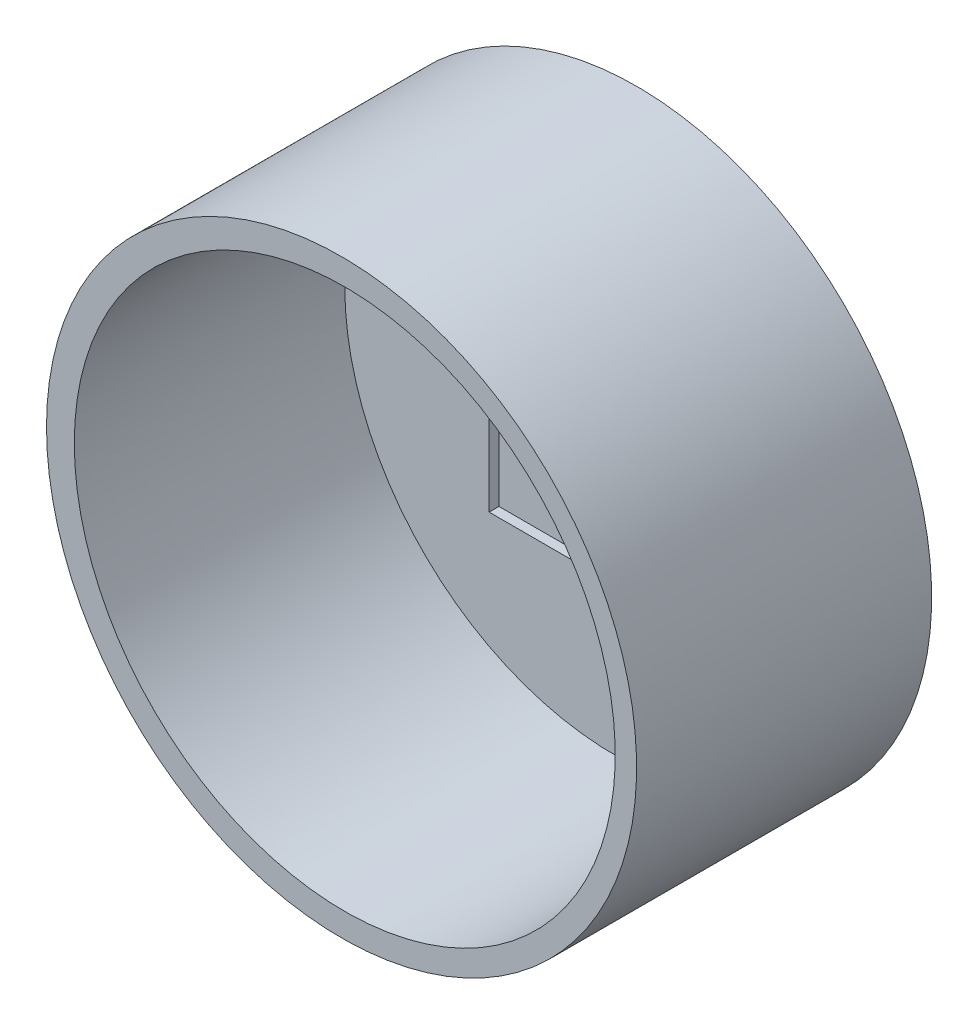
from build123d import *

# Parameters (mm, degrees)
SKETCH1_R           = 76.2
SKETCH1_R_2         = 69.85
BOSS_EXTRUDE1_DEPTH = 76.2
SKETCH3_R           = 76.2
BOSS_EXTRUDE2_DEPTH = 6.35
SKETCH4_W           = 63.5
SKETCH4_H           = 63.5
CUT_EXTRUDE1_DEPTH  = 2.54


with BuildPart() as part:
    # Sketch1 → Boss-Extrude1 (new body)
    with BuildSketch(Plane.XY):
        Circle(SKETCH1_R)
        with Locations((0.828825483, 0)):
            Circle(SKETCH1_R_2, mode=Mode.SUBTRACT)
    extrude(amount=BOSS_EXTRUDE1_DEPTH)

    # Sketch3 → Boss-Extrude2 (add)
    with BuildSketch(Plane.XY):
        Circle(SKETCH3_R)
    extrude(amount=BOSS_EXTRUDE2_DEPTH)

    # Sketch4 → Cut-Extrude1 (cut)
    with BuildSketch(Plane.XY.offset(6.35)):
        Rectangle(SKETCH4_W, SKETCH4_H)
    extrude(amount=-CUT_EXTRUDE1_DEPTH, mode=Mode.SUBTRACT)


solid = part.part
